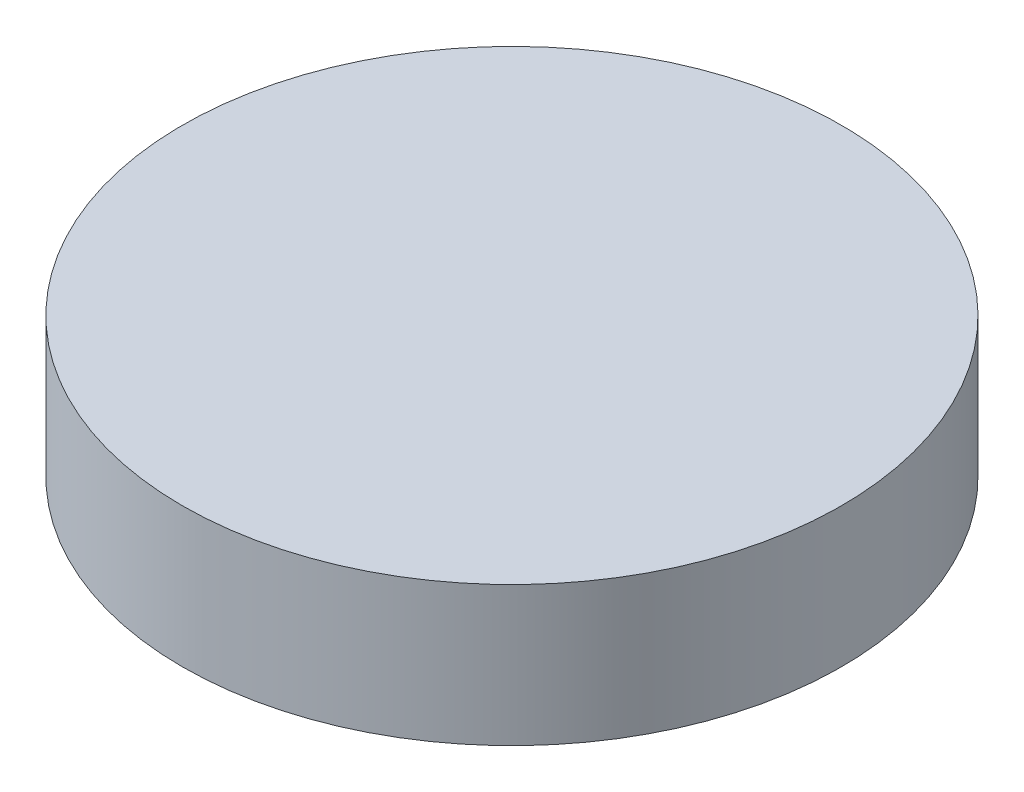
from build123d import *

# Parameters (mm, degrees)
ESQUISSE1_R        = 15
BOSS_EXTRU_1_DEPTH = 6.35


with BuildPart() as part:
    # Esquisse1 → Boss.-Extru.1 (new body)
    with BuildSketch(Plane(origin=(0, 0, 0), x_dir=(1, 0, 0), z_dir=(0, 1, 0))):
        Circle(ESQUISSE1_R)
    extrude(amount=BOSS_EXTRU_1_DEPTH)


solid = part.part
